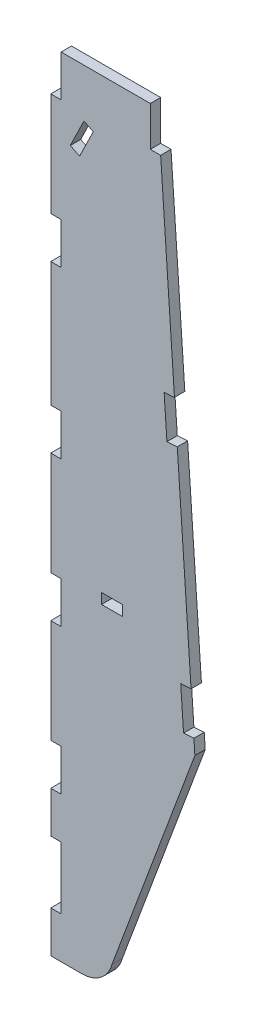
from build123d import *

# Parameters (mm, degrees)
ESQUISSE1_W        = 10
ESQUISSE1_H        = 5
BOSS_EXTRU_1_DEPTH = 5


with BuildPart() as part:
    # Esquisse1 → Boss.-Extru.1 (new body)
    with BuildSketch(Plane.XY):
        with BuildLine():
            Line((0, 0), (43, 0))
            Line((43, 0), (43, -19.161428707))
            Line((43, -19.161428707), (48, -19.161428707))
            Line((48, -19.161428707), (54.654320988, -116.935249396))
            Line((54.654320988, -116.935249396), (49.665860748, -117.274755569))
            Line((49.665860748, -117.274755569), (51.02388544, -137.228596526))
            Line((51.02388544, -137.228596526), (56.012345679, -136.889090353))
            Line((56.012345679, -136.889090353), (62.666666667, -234.662911043))
            Line((62.666666667, -234.662911043), (57.678206427, -235.002417215))
            Line((57.678206427, -235.002417215), (59.036231119, -254.956258173))
            Line((59.036231119, -254.956258173), (64.024691358, -254.616752))
            Line((64.024691358, -254.616752), (64.5, -261.600596335))
            Line((64.5, -261.600596335), (24.488887394, -368.882285677))
            ThreePointArc((24.488887394, -368.882285677), (19.131421435, -376.900300104), (10, -380))
            Line((10, -380), (-5, -380))
            Line((-5, -380), (-5, -360))
            Line((-5, -360), (0, -360))
            Line((0, -360), (0, -330))
            Line((0, -330), (-5, -330))
            Line((-5, -330), (-5, -310))
            Line((-5, -310), (0, -310))
            Line((0, -310), (0, -290))
            Line((0, -290), (-5, -290))
            Line((-5, -290), (-5, -240))
            Line((-5, -240), (0, -240))
            Line((0, -240), (0, -220))
            Line((0, -220), (-5, -220))
            Line((-5, -220), (-5, -170))
            Line((-5, -170), (0, -170))
            Line((0, -170), (0, -150))
            Line((0, -150), (-5, -150))
            Line((-5, -150), (-5, -90))
            Line((-5, -90), (0, -90))
            Line((0, -90), (0, -70))
            Line((0, -70), (-5, -70))
            Line((-5, -70), (-5, -20))
            Line((-5, -20), (0, -20))
            Line((0, -20), (0, 0))
        make_face()
        with Locations((24.5, -218.5)):
            Rectangle(ESQUISSE1_W, ESQUISSE1_H, mode=Mode.SUBTRACT)
        Polygon((11.000546858, -23.352307985), (4.424979656, -36.83421868), (8.918949887, -39.026074414), (15.494517089, -25.544163719), align=None, mode=Mode.SUBTRACT)
    extrude(amount=BOSS_EXTRU_1_DEPTH)


solid = part.part
